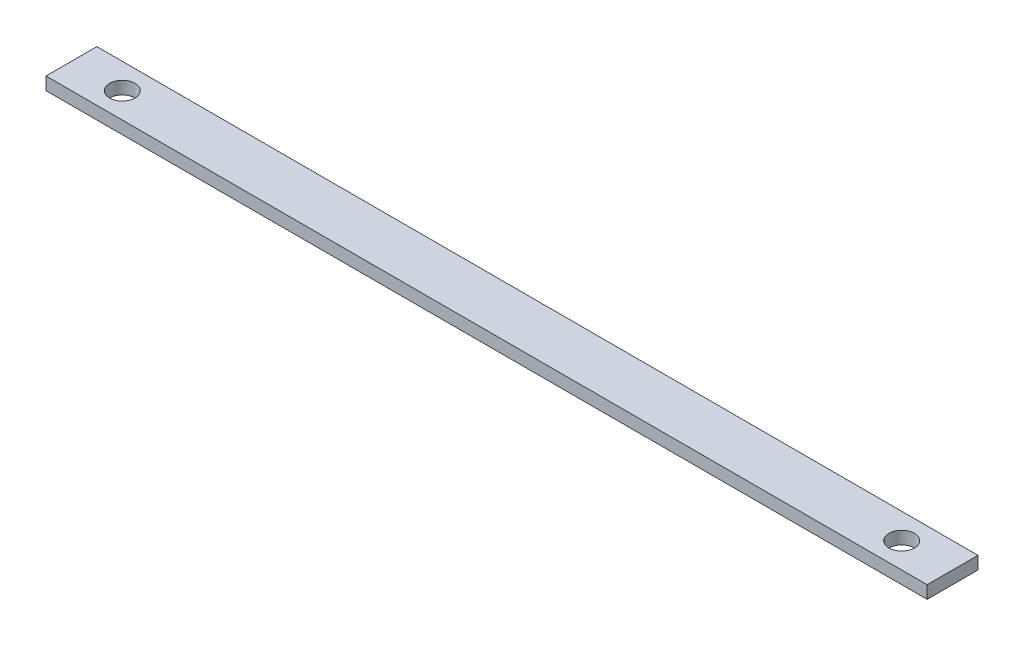
from build123d import *

# Parameters (mm, degrees)
SKETCH1_W           = 219.964
SKETCH1_H           = 12.7
BOSS_EXTRUDE1_DEPTH = 3.175
SKETCH2_R           = 3.175
CUT_EXTRUDE1_DEPTH  = 221.353198118


with BuildPart() as part:
    # Sketch1 → Boss-Extrude1 (new body)
    with BuildSketch(Plane(origin=(0, 0, 0), x_dir=(1, 0, 0), z_dir=(0, 1, 0))):
        with Locations((109.982, 6.35)):
            Rectangle(SKETCH1_W, SKETCH1_H)
    extrude(amount=BOSS_EXTRUDE1_DEPTH)

    # Sketch2 → Cut-Extrude1 (cut, through all)
    with BuildSketch(Plane(origin=(0, 3.175, 0), x_dir=(1, 0, 0), z_dir=(0, 1, 0))):
        with Locations((12.7, 6.35)):
            Circle(SKETCH2_R)
        with Locations((207.264, 6.35)):
            Circle(SKETCH2_R)
    extrude(amount=-CUT_EXTRUDE1_DEPTH, mode=Mode.SUBTRACT)


solid = part.part
